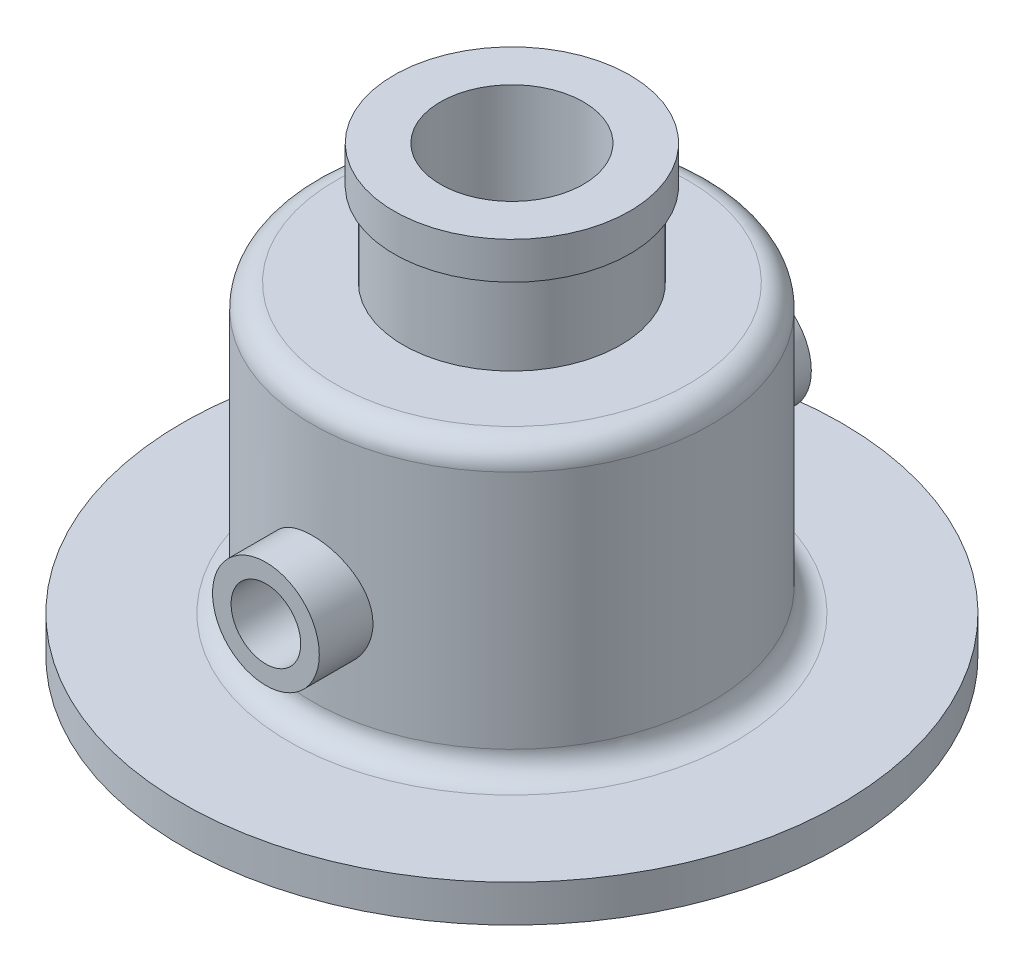
from build123d import *
from build123d.topology import SkipClean

# Parameters (mm, degrees)
SALIENTE_EXTRUIR2_DEPTH      = 53
SALIENTE_EXTRUIR2_DEPTH_BACK = 53
CROQUIS2_R                   = 11.5
CROQUIS2_R_2                 = 7.5
CROQUIS3_R                   = 7.5
CORTAR_EXTRUIR1_DEPTH        = 175.807007869
CORTAR_EXTRUIR3_START        = 26.000000049
CORTAR_EXTRUIR3_OUTLINE_R    = 35
CORTAR_EXTRUIR3_DEPTH        = 23.000000051


# Read off the part's stored shape, not the designer's step: Cortar-Extruir3
with BuildPart() as part:
    # Croquis1 → Revolución3 (revolve)
    with BuildSketch(Plane.XY, mode=Mode.PRIVATE) as revoluci_n3_sk:
        with BuildLine():
            Line((32, 0), (32, 3))
            ThreePointArc((32, 3), (32.585786438, 4.414213562), (34, 5))
            Line((34, 5), (71, 5))
            Line((71, 5), (71, 13))
            Line((71, 13), (48, 13))
            ThreePointArc((48, 13), (44.464466094, 14.464466094), (43, 18))
            Line((43, 18), (43, 26))
            Line((43, 26), (43, 49))
            Line((43, 49), (43, 69.7))
            ThreePointArc((43, 69.7), (41.535533906, 73.235533906), (38, 74.7))
            Line((38, 74.7), (23.4, 74.7))
            Line((23.4, 74.7), (23.4, 92.7))
            Line((23.4, 92.7), (25.4, 92.7))
            Line((25.4, 92.7), (25.4, 100.7))
            Line((25.4, 100.7), (15.4, 100.7))
            Line((15.4, 100.7), (15.4, 58))
            Line((15.4, 58), (17.4, 55))
            Line((17.4, 55), (25.4, 55))
            Line((25.4, 55), (25.4, 60))
            ThreePointArc((25.4, 60), (31.924283374, 59.297319975), (35, 53.500769276))
            Line((35, 53.500769276), (35, 45))
            Line((35, 45), (35, 30))
            Line((35, 30), (35, 23))
            ThreePointArc((35, 23), (33.535533906, 19.464466094), (30, 18))
            Line((30, 18), (25, 18))
            Line((25, 18), (25, 0))
            Line((25, 0), (32, 0))
        make_face()
    revolve(revoluci_n3_sk.sketch.rotate(Axis((0, 0, 0), (0, 1, 0)), 90), axis=Axis((0, 0, 0), (0, 1, 0)))

    # Croquis2 → Saliente-Extruir2 (add, two sides: drawn at the far end of the back side and taken through both)
    with BuildSketch(Plane.XY.offset(-SALIENTE_EXTRUIR2_DEPTH_BACK)):
        with Locations((0, 37.5)):
            Circle(CROQUIS2_R)
        with Locations((0, 37.5)):
            Circle(CROQUIS2_R_2, mode=Mode.SUBTRACT)
    extrude(amount=SALIENTE_EXTRUIR2_DEPTH + SALIENTE_EXTRUIR2_DEPTH_BACK)

    # Croquis3 → Cortar-Extruir1 (cut, through all)
    with BuildSketch(Plane.XY.offset(53)):
        with Locations((0, 37.5)):
            Circle(CROQUIS3_R)
    extrude(amount=-CORTAR_EXTRUIR1_DEPTH, mode=Mode.SUBTRACT)

    # Cortar-Extruir3 outline → Cortar-Extruir3 (cut)
    with SkipClean():  # the faces are left unmerged after this step: merging them gives an invalid solid
        with BuildSketch(Plane(origin=(0, 0, 0), x_dir=(1, 0, 0), z_dir=(0, 1, 0)).offset(CORTAR_EXTRUIR3_START)):
            Circle(CORTAR_EXTRUIR3_OUTLINE_R)
        extrude(amount=CORTAR_EXTRUIR3_DEPTH, mode=Mode.SUBTRACT)


solid = part.part
